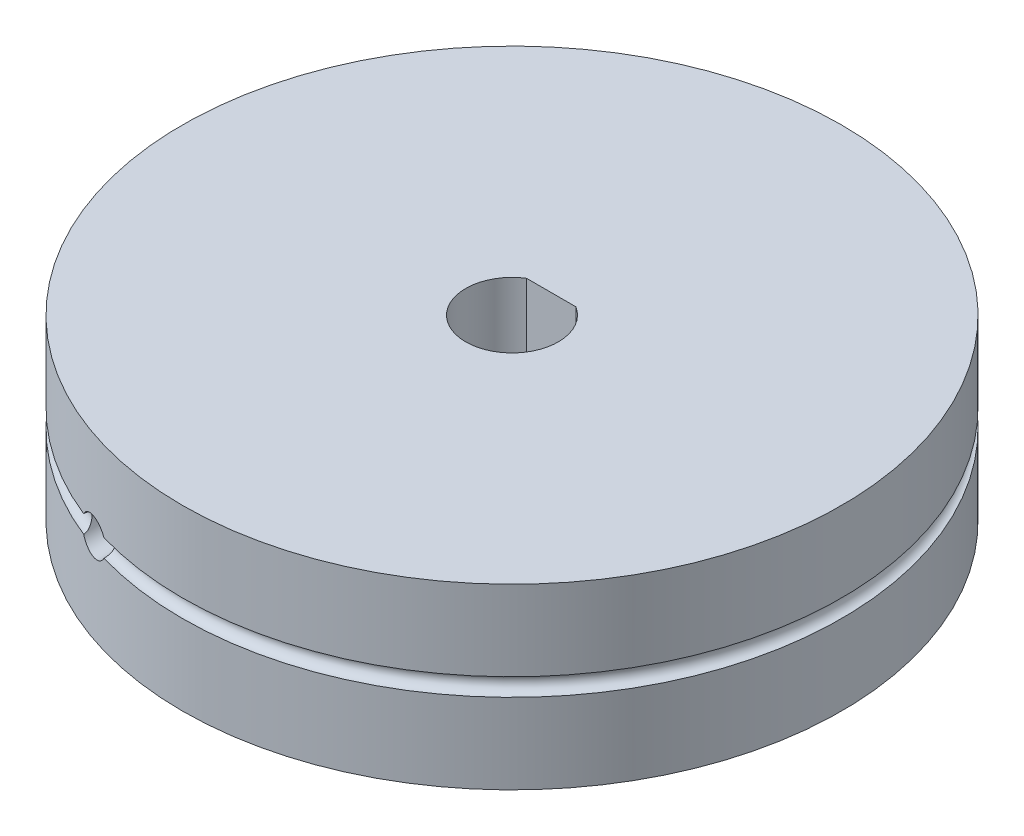
from build123d import *

# Parameters (mm, degrees)
SKETCH1_R                      = 18.5
BOSS_EXTRUDE1_DEPTH            = 10
SKETCH2_R                      = 0.5
CUT_EXTRUDE1_REACH             = 30.009
CUT_EXTRUDE2_REACH             = 30.009
SKETCH4_R                      = 1
CUT_EXTRUDE2_DIRECTION_2_REACH = 30.009


with BuildPart() as part:
    # Sketch1 → Boss-Extrude1 (new body)
    with BuildSketch(Plane(origin=(0, 0, 0), x_dir=(1, 0, 0), z_dir=(0, 1, 0))):
        Circle(SKETCH1_R)
    extrude(amount=BOSS_EXTRUDE1_DEPTH)

    # Sketch2 → Cut-Revolve1 (revolve, cut)
    with BuildSketch(Plane.XY):
        with Locations((-18.5, 5)):
            Circle(SKETCH2_R)
    revolve(axis=Axis((0, 22.422972825, 0), (0, -1, 0)), mode=Mode.SUBTRACT)

    # Sketch3 → Cut-Extrude1 (cut, up to next)
    with BuildSketch(Plane(origin=(0, 10, 0), x_dir=(1, 0, 0), z_dir=(0, 1, 0)), mode=Mode.PRIVATE) as cut_extrude1_sk1:
        with BuildLine():
            Line((1.385640646, 2.2), (-1.385640646, 2.2))
            ThreePointArc((-1.385640646, 2.2), (-1.256450222, -2.276254125), (2.6, 0))
            ThreePointArc((2.6, 0), (2.276254125, 1.256450222), (1.385640646, 2.2))
        make_face()
    cut_extrude1_tool1 = extrude(cut_extrude1_sk1.sketch, amount=-CUT_EXTRUDE1_REACH, mode=Mode.PRIVATE) & part.part
    add(cut_extrude1_tool1.solids().sort_by_distance((0, 10, 0.086577))[0], mode=Mode.SUBTRACT)

    # Sketch4 → Cut-Extrude2 (cut, up to next)
    with BuildSketch(Plane.XY, mode=Mode.PRIVATE) as cut_extrude2_sk1:
        with Locations((-6, 5)):
            Circle(SKETCH4_R)
    cut_extrude2_tool1 = extrude(cut_extrude2_sk1.sketch, amount=-CUT_EXTRUDE2_REACH, mode=Mode.PRIVATE) & part.part
    add(cut_extrude2_tool1.solids().sort_by_distance((-6, 5, 0))[0], mode=Mode.SUBTRACT)

    # Sketch4 → Cut-Extrude2 direction 2 (cut, up to next)
    with BuildSketch(Plane.XY, mode=Mode.PRIVATE) as cut_extrude2_direction_2_sk1:
        with Locations((-6, 5)):
            Circle(SKETCH4_R)
    cut_extrude2_direction_2_tool1 = extrude(cut_extrude2_direction_2_sk1.sketch, amount=CUT_EXTRUDE2_DIRECTION_2_REACH, mode=Mode.PRIVATE) & part.part
    add(cut_extrude2_direction_2_tool1.solids().sort_by_distance((-6, 5, 0))[0], mode=Mode.SUBTRACT)


solid = part.part
